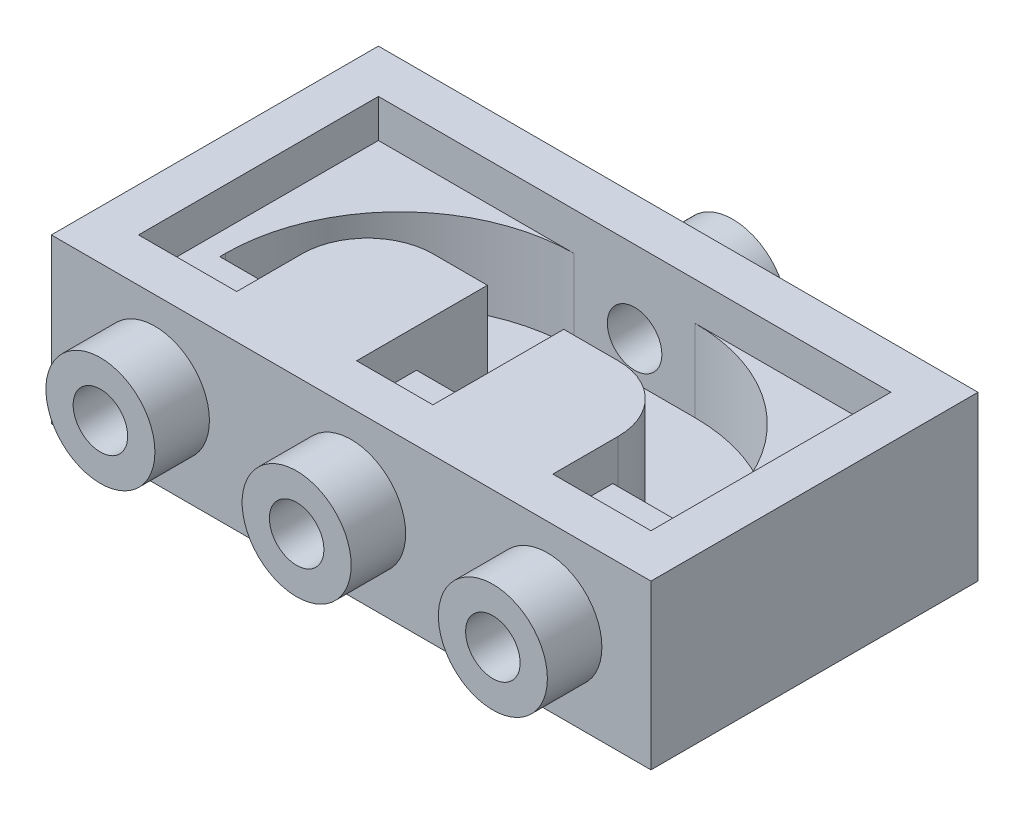
from build123d import *

# Parameters (mm, degrees)
SKETCH1_W               = 110
SKETCH1_H               = 30
BOSS_EXTRUDE1_DEPTH     = 60
SKETCH5_R               = 10
BOSS_EXTRUDE3_DEPTH     = 10
SKETCH8_R               = 5
CUT_EXTRUDE2_DEPTH      = 18
BOSS_EXTRUDE4_START     = 10
SKETCH6_R               = 10
BOSS_EXTRUDE4_DEPTH     = 10
CUT_EXTRUDE3_START      = -18
SKETCH7_R               = 5
CUT_EXTRUDE3_DEPTH      = 18
SHELL6_START            = 8
SHELL6_OUTLINE_W        = 94
SHELL6_OUTLINE_H        = 22
SHELL6_DEPTH            = 44
SKETCH9_W               = 22
SKETCH9_H               = 24
BOSS_EXTRUDE5_DEPTH     = 22
FILLET2_R               = 12
SKETCH12_W              = 14
SKETCH12_H              = 16
BOSS_EXTRUDE8_DEPTH     = 11
SKETCH13_R              = 7
CUT_EXTRUDE4_DEPTH      = 11
CUT_EXTRUDE4_DRAFT      = -10
SKETCH14_W              = 18
SKETCH14_H              = 15
BOSS_EXTRUDE9_DEPTH     = 11
SKETCH16_R              = 7
CUT_EXTRUDE5_DEPTH      = 11
CUT_EXTRUDE5_DRAFT      = -10
SKETCH19_W              = 3.903707596
SKETCH19_H              = 15
BOSS_EXTRUDE11_DEPTH    = 33.5
FILLET3_R               = 32
MIRROR5_COPY_1_SKETCH_R = 7
MIRROR5_COPY_1_DEPTH    = 11
MIRROR5_COPY_1_DRAFT    = -10
FILLET3_OF_MIRROR5_R    = 32


# Read off the part's stored shape, not the designer's step: Shell6
with BuildPart() as part:
    # Sketch1 → Boss-Extrude1 (new body)
    with BuildSketch(Plane.XY):
        with Locations((-55, 15)):
            Rectangle(SKETCH1_W, SKETCH1_H)
    extrude(amount=BOSS_EXTRUDE1_DEPTH)

    # Sketch5 → Boss-Extrude3 (add)
    with BuildSketch(Plane.XY.offset(60)):
        with Locations((-91, 15)):
            Circle(SKETCH5_R)
        with Locations((-55, 15)):
            Circle(SKETCH5_R)
        with Locations((-19, 15)):
            Circle(SKETCH5_R)
    extrude(amount=BOSS_EXTRUDE3_DEPTH)

    # Sketch8 → Cut-Extrude2 (cut)
    with BuildSketch(Plane.XY.offset(70)):
        with Locations((-91, 15)):
            Circle(SKETCH8_R)
        with Locations((-55, 15)):
            Circle(SKETCH8_R)
        with Locations((-19, 15)):
            Circle(SKETCH8_R)
    extrude(amount=-CUT_EXTRUDE2_DEPTH, mode=Mode.SUBTRACT)

    # Sketch6 → Boss-Extrude4 (add)
    with BuildSketch(Plane(origin=(0, 0, 0), x_dir=(-1, 0, 0), z_dir=(0, 0, -1)).offset(BOSS_EXTRUDE4_START)):
        with Locations(Location((55, 15, 0), (0, 0, 180))):
            Circle(SKETCH6_R)
    extrude(amount=-BOSS_EXTRUDE4_DEPTH)

    # Sketch7 → Cut-Extrude3 (cut)
    with BuildSketch(Plane(origin=(0, 0, -10), x_dir=(-1, 0, 0), z_dir=(0, 0, -1)).offset(CUT_EXTRUDE3_START)):
        with Locations(Location((55, 15, 0), (0, 0, 180))):
            Circle(SKETCH7_R)
    extrude(amount=CUT_EXTRUDE3_DEPTH, mode=Mode.SUBTRACT)

    # Shell6 outline → Shell6 (cut)
    with BuildSketch(Plane.XY.offset(SHELL6_START)):
        with Locations((-55, 19)):
            Rectangle(SHELL6_OUTLINE_W, SHELL6_OUTLINE_H)
    extrude(amount=SHELL6_DEPTH, mode=Mode.SUBTRACT)

    # Sketch9 → Boss-Extrude5 (add)
    with BuildSketch(Plane(origin=(0, 8, 0), x_dir=(1, 0, 0), z_dir=(0, 1, 0))):
        with Locations((-73, -40)):
            Rectangle(SKETCH9_W, SKETCH9_H)
    boss_extrude5 = extrude(amount=BOSS_EXTRUDE5_DEPTH)

    # Mirror1: Boss-Extrude5 across plane
    add(boss_extrude5.mirror(Plane.ZY.offset(55)))

    # Fillet2
    fillet2_edges = [part.edges().sort_by_distance(p)[0] for p in [
        (-84, 19, 28),
        (-26, 19, 28),
    ]]
    fillet(fillet2_edges, radius=FILLET2_R)

    # Sketch12 → Boss-Extrude8 (add)
    with BuildSketch(Plane(origin=(0, 0, 52), x_dir=(-1, 0, 0), z_dir=(0, 0, -1))):
        with Locations((55, 15)):
            Rectangle(SKETCH12_W, SKETCH12_H)
    extrude(amount=BOSS_EXTRUDE8_DEPTH)


with BuildPart() as cut_extrude4_tool:
    # Sketch13 → Cut-Extrude4 (with draft: the straight prism first)
    with BuildSketch(Plane(origin=(0, 0, 41), x_dir=(-1, 0, 0), z_dir=(0, 0, -1))):
        with Locations((55, 15)):
            Circle(SKETCH13_R)
    extrude(amount=-CUT_EXTRUDE4_DEPTH)
    # Cut-Extrude4: the draft: its side faces are tilted about the plane it starts from
    cut_extrude4_sides = [cut_extrude4_tool.faces().sort_by_distance(p)[0] for p in [
        (-48, 15, 46.5),
    ]]
    draft(cut_extrude4_sides, Plane(origin=(0, 0, 41), x_dir=(-1, 0, 0), z_dir=(0, 0, -1)), CUT_EXTRUDE4_DRAFT)


with BuildPart() as part_1:
    add(part.part)

    # Cut-Extrude4: cut by cut_extrude4_tool
    add(cut_extrude4_tool.part, mode=Mode.SUBTRACT)

    # Sketch14 → Boss-Extrude9 (add)
    with BuildSketch(Plane(origin=(0, 0, 52), x_dir=(-1, 0, 0), z_dir=(0, 0, -1))):
        with Locations((17, 15.5)):
            Rectangle(SKETCH14_W, SKETCH14_H)
    boss_extrude9 = extrude(amount=BOSS_EXTRUDE9_DEPTH)


with BuildPart() as cut_extrude5_tool:
    # Sketch16 → Cut-Extrude5 (with draft: the straight prism first)
    with BuildSketch(Plane(origin=(0, 0, 41), x_dir=(-1, 0, 0), z_dir=(0, 0, -1))):
        with Locations((19, 15)):
            Circle(SKETCH16_R)
    extrude(amount=-CUT_EXTRUDE5_DEPTH)
    # Cut-Extrude5: the draft: its side faces are tilted about the plane it starts from
    cut_extrude5_sides = [cut_extrude5_tool.faces().sort_by_distance(p)[0] for p in [
        (-12, 15, 46.5),
    ]]
    draft(cut_extrude5_sides, Plane(origin=(0, 0, 41), x_dir=(-1, 0, 0), z_dir=(0, 0, -1)), CUT_EXTRUDE5_DRAFT)


with BuildPart() as part_2:
    add(part_1.part)

    # Cut-Extrude5: cut by cut_extrude5_tool
    add(cut_extrude5_tool.part, mode=Mode.SUBTRACT)

    # Sketch19 → Boss-Extrude11 (add)
    with BuildSketch(Plane(origin=(0, 0, 41), x_dir=(-1, 0, 0), z_dir=(0, 0, -1))):
        with Locations((9.951853798, 15.5)):
            Rectangle(SKETCH19_W, SKETCH19_H)
    boss_extrude11 = extrude(amount=BOSS_EXTRUDE11_DEPTH)

    # Fillet3
    fillet3_edges = [part_2.edges().sort_by_distance(p)[0] for p in [
        (-11.903707596, 15.5, 8),
    ]]
    fillet(fillet3_edges, radius=FILLET3_R)

    # Mirror5: Boss-Extrude9, Boss-Extrude11 across plane
    add(boss_extrude9.mirror(Plane.ZY.offset(55)))
    add(boss_extrude11.mirror(Plane.ZY.offset(55)))


with BuildPart() as mirror5_copy_1_tool:
    # Mirror5 copy 1 sketch → Mirror5 copy 1 (with draft: the straight prism first)
    with BuildSketch(Plane(origin=(-110, 0, 41), x_dir=(1, 0, 0), z_dir=(0, 0, -1))):
        with Locations((19, -15)):
            Circle(MIRROR5_COPY_1_SKETCH_R)
    extrude(amount=-MIRROR5_COPY_1_DEPTH)
    # Mirror5 copy 1: the draft: its side faces are tilted about the plane it starts from
    mirror5_copy_1_sides = [mirror5_copy_1_tool.faces().sort_by_distance(p)[0] for p in [
        (-98, 15, 46.5),
    ]]
    draft(mirror5_copy_1_sides, Plane(origin=(-110, 0, 41), x_dir=(1, 0, 0), z_dir=(0, 0, -1)), MIRROR5_COPY_1_DRAFT)


with BuildPart() as part_3:
    add(part_2.part)

    # Mirror5 copy 1: cut by mirror5_copy_1_tool
    add(mirror5_copy_1_tool.part, mode=Mode.SUBTRACT)

    # Fillet3 of Mirror5
    fillet3_of_mirror5_edges = [part_3.edges().sort_by_distance(p)[0] for p in [
        (-98.096292404, 15.5, 8),
    ]]
    fillet(fillet3_of_mirror5_edges, radius=FILLET3_OF_MIRROR5_R)


solid = part_3.part
